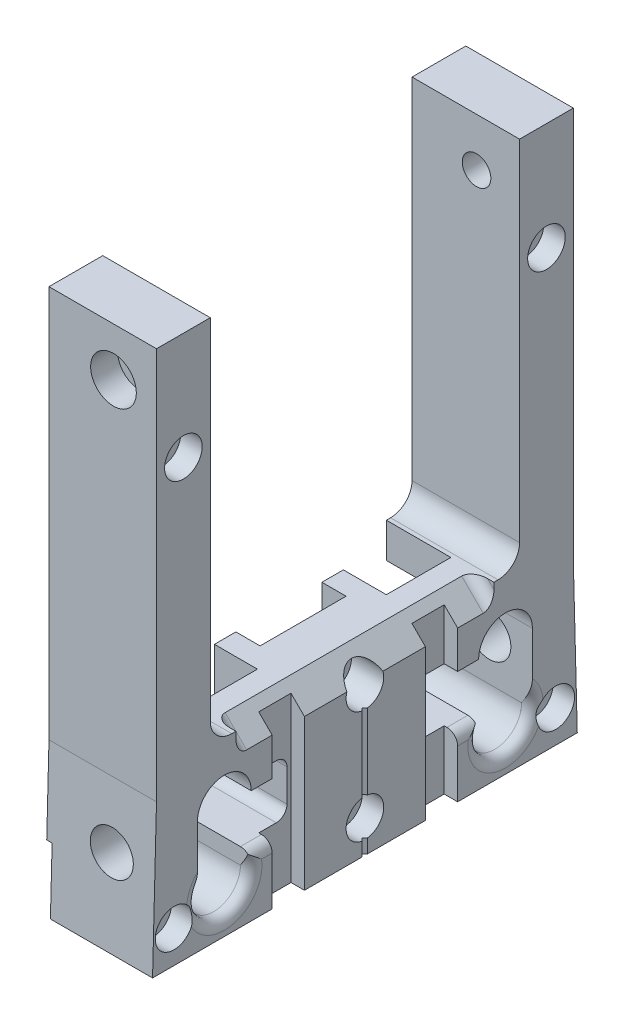
from build123d import *

# Parameters (mm, degrees)
SKETCH1_W                                         = 31.75
SKETCH1_H                                         = 160.3375
EXTRUDE1_DEPTH                                    = 62.70625
EXTRUDE2_DEPTH                                    = 107.616906566
EXTRUDE3_REACH                                    = 108.617
SKETCH15_W                                        = 3.96875
SKETCH15_H                                        = 9.525
EXTRUDE6_DEPTH                                    = 173.893618507
CUT_EXTRUDE1_DEPTH                                = 107.616906566
SKETCH17_W                                        = 1.5875
SKETCH17_H                                        = 19.177
CUT_EXTRUDE2_DEPTH                                = 96.8375
CBORE_FOR_1_4_SOCKET_HEAD_CAP_SCREW4_D            = 6.7564
CBORE_FOR_1_4_SOCKET_HEAD_CAP_SCREW4_CBORE_D      = 11.1125
CBORE_FOR_1_4_SOCKET_HEAD_CAP_SCREW4_CBORE_DEPTH  = 6.35
CBORE_FOR_5_16_SOCKET_HEAD_CAP_SCREW2_D           = 8.4328
CBORE_FOR_5_16_SOCKET_HEAD_CAP_SCREW2_DEPTH       = 15.875
CBORE_FOR_5_16_SOCKET_HEAD_CAP_SCREW2_CBORE_D     = 13.49502
CBORE_FOR_5_16_SOCKET_HEAD_CAP_SCREW2_CBORE_DEPTH = 7.9375
CBORE_FOR_5_16_SOCKET_HEAD_CAP_SCREW3_D           = 8.4328
CBORE_FOR_5_16_SOCKET_HEAD_CAP_SCREW3_CBORE_D     = 13.49502
CBORE_FOR_5_16_SOCKET_HEAD_CAP_SCREW3_CBORE_DEPTH = 7.9375
CBORE_FOR_1_4_SOCKET_HEAD_CAP_SCREW2_D            = 6.7564
CBORE_FOR_1_4_SOCKET_HEAD_CAP_SCREW2_CBORE_D      = 11.1125
CBORE_FOR_1_4_SOCKET_HEAD_CAP_SCREW2_CBORE_DEPTH  = 6.35
FILLET1_R                                         = 3.175
SKETCH32_R                                        = 6.35
CUT_EXTRUDE7_DEPTH                                = 22.225
CUT_EXTRUDE8_START                                = 22.225
SKETCH33_R                                        = 6.35
CUT_EXTRUDE8_DEPTH                                = 22.225
SKETCH41_W                                        = 19.05
SKETCH41_H                                        = 25.520262047
CUT_EXTRUDE9_DEPTH                                = 19.05
SKETCH43_W                                        = 6.35
SKETCH43_H                                        = 38.0746
CUT_EXTRUDE11_DEPTH                               = 22.225
CUT_EXTRUDE12_DEPTH                               = 7.14375
CBORE_FOR_1_4_SOCKET_HEAD_CAP_SCREW5_D            = 6.7564
CBORE_FOR_1_4_SOCKET_HEAD_CAP_SCREW5_CBORE_D      = 11.1125
CBORE_FOR_1_4_SOCKET_HEAD_CAP_SCREW5_CBORE_DEPTH  = 9.525
FILLET2_R                                         = 3.175
FILLET3_R                                         = 3.175
CUT_EXTRUDE13_DEPTH                               = 173.893618516
CUT_EXTRUDE14_DEPTH                               = 38.1
FILLET4_R                                         = 3.175


with BuildPart() as part:
    # Sketch1 → Extrude1 (new, symmetric)
    with BuildSketch(Plane.XY):
        Rectangle(SKETCH1_W, SKETCH1_H)
    extrude(amount=EXTRUDE1_DEPTH, both=True)

    # Sketch2 → Extrude2 (cut, through all)
    with BuildSketch(Plane(origin=(15.875, 0, 0), x_dir=(0, 0, -1), z_dir=(1, 0, 0))):
        Polygon((-62.70625, -80.16875), (-61.542285786, -35.71875), (-61.542285786, 80.16875), (-62.70625, 80.16875), align=None)
        Polygon((62.70625, -80.16875), (61.542285786, -35.71875), (61.542285786, 80.16875), (62.70625, 80.16875), align=None)
    extrude(amount=-EXTRUDE2_DEPTH, mode=Mode.SUBTRACT)

    # Sketch3 → Extrude3 (cut, up to next)
    with BuildSketch(Plane(origin=(15.875, 0, 0), x_dir=(0, 0, -1), z_dir=(1, 0, 0)), mode=Mode.PRIVATE) as extrude3_sk1:
        with BuildLine():
            Line((-19.0373, -59.53125), (-19.0373, -50.00625))
            ThreePointArc((-19.0373, -50.00625), (-19.96723597, -47.76118597), (-22.2123, -46.83125))
            Line((-22.2123, -46.83125), (-33.5788, -46.83125))
            ThreePointArc((-33.5788, -46.83125), (-41.5163, -38.89375), (-49.4538, -46.83125))
            Line((-49.4538, -46.83125), (-49.4538, -67.46875))
            ThreePointArc((-49.4538, -67.46875), (-41.5163, -75.40625), (-33.5788, -67.46875))
            Line((-33.5788, -67.46875), (-33.5788, -62.70625))
            Line((-33.5788, -62.70625), (-22.2123, -62.70625))
            ThreePointArc((-22.2123, -62.70625), (-19.96723597, -61.77631403), (-19.0373, -59.53125))
        make_face()
    extrude3_tool1 = extrude(extrude3_sk1.sketch, amount=-EXTRUDE3_REACH, mode=Mode.PRIVATE) & part.part
    # Sketch3 → Extrude3 (cut, up to next)
    with BuildSketch(Plane(origin=(15.875, 0, 0), x_dir=(0, 0, -1), z_dir=(1, 0, 0)), mode=Mode.PRIVATE) as extrude3_sk2:
        with BuildLine():
            Line((49.4538, -67.46875), (49.4538, -46.83125))
            ThreePointArc((49.4538, -46.83125), (41.5163, -38.89375), (33.5788, -46.83125))
            Line((33.5788, -46.83125), (22.2123, -46.83125))
            ThreePointArc((22.2123, -46.83125), (19.96723597, -47.76118597), (19.0373, -50.00625))
            Line((19.0373, -50.00625), (19.0373, -59.53125))
            ThreePointArc((19.0373, -59.53125), (19.96723597, -61.77631403), (22.2123, -62.70625))
            Line((22.2123, -62.70625), (33.5788, -62.70625))
            Line((33.5788, -62.70625), (33.5788, -67.46875))
            ThreePointArc((33.5788, -67.46875), (41.5163, -75.40625), (49.4538, -67.46875))
        make_face()
    extrude3_tool2 = extrude(extrude3_sk2.sketch, amount=-EXTRUDE3_REACH, mode=Mode.PRIVATE) & part.part
    add(extrude3_tool1.solids().sort_by_distance((15.875, -56.432782, 36.973416))[0], mode=Mode.SUBTRACT)
    add(extrude3_tool2.solids().sort_by_distance((15.875, -56.432782, -36.973416))[0], mode=Mode.SUBTRACT)

    # Sketch15 → Extrude6 (cut, through all)
    with BuildSketch(Plane(origin=(0, 80.16875, 0), x_dir=(1, 0, 0), z_dir=(0, 1, 0))):
        with Locations((13.890625, -22.621875)):
            Rectangle(SKETCH15_W, SKETCH15_H)
        with Locations((13.890625, 22.621875)):
            Rectangle(SKETCH15_W, SKETCH15_H)
    extrude(amount=-EXTRUDE6_DEPTH, mode=Mode.SUBTRACT)

    # Sketch16 → Cut-Extrude1 (cut, through all)
    with BuildSketch(Plane(origin=(15.875, 0, 0), x_dir=(0, 0, -1), z_dir=(1, 0, 0))):
        with BuildLine():
            Line((-45.667285786, 80.16875), (45.667285786, 80.16875))
            Line((45.667285786, 80.16875), (45.667285786, -23.01875))
            ThreePointArc((45.667285786, -23.01875), (43.807413847, -27.508878061), (39.317285786, -29.36875))
            Line((39.317285786, -29.36875), (-39.317285786, -29.36875))
            ThreePointArc((-39.317285786, -29.36875), (-43.807413847, -27.508878061), (-45.667285786, -23.01875))
            Line((-45.667285786, -23.01875), (-45.667285786, 80.16875))
        make_face()
    extrude(amount=-CUT_EXTRUDE1_DEPTH, mode=Mode.SUBTRACT)

    # Sketch17 → Cut-Extrude2 (cut, symmetric)
    with BuildSketch(Plane.XY):
        with Locations((-15.08125, -70.58025)):
            Rectangle(SKETCH17_W, SKETCH17_H)
    extrude(amount=CUT_EXTRUDE2_DEPTH, both=True, mode=Mode.SUBTRACT)

    # CBORE for 1/4 Socket Head Cap Screw4 (through all)
    with Locations(Plane(origin=(15.875, 0, 0), x_dir=(0, 0, -1), z_dir=(1, 0, 0))):
        with Locations((-56.35625, -70.58025), (56.35625, -70.58025), (0, -70.58025)):
            CounterBoreHole(CBORE_FOR_1_4_SOCKET_HEAD_CAP_SCREW4_D / 2, CBORE_FOR_1_4_SOCKET_HEAD_CAP_SCREW4_CBORE_D / 2, CBORE_FOR_1_4_SOCKET_HEAD_CAP_SCREW4_CBORE_DEPTH)

    # CBORE for 5/16 Socket Head Cap Screw2
    with Locations(Plane(origin=(0, 0, -61.542285786), x_dir=(-1, 0, 0), z_dir=(0, 0, -1))):
        with Locations((-3.175, 65.88125)):
            CounterBoreHole(CBORE_FOR_5_16_SOCKET_HEAD_CAP_SCREW2_D / 2, CBORE_FOR_5_16_SOCKET_HEAD_CAP_SCREW2_CBORE_D / 2, CBORE_FOR_5_16_SOCKET_HEAD_CAP_SCREW2_CBORE_DEPTH, depth=CBORE_FOR_5_16_SOCKET_HEAD_CAP_SCREW2_DEPTH)

    # CBORE for 5/16 Socket Head Cap Screw3 (through all)
    with Locations(Plane.XY.offset(61.542285786)):
        with Locations((3.175, 65.88125)):
            CounterBoreHole(CBORE_FOR_5_16_SOCKET_HEAD_CAP_SCREW3_D / 2, CBORE_FOR_5_16_SOCKET_HEAD_CAP_SCREW3_CBORE_D / 2, CBORE_FOR_5_16_SOCKET_HEAD_CAP_SCREW3_CBORE_DEPTH)

    # CBORE for 1/4 Socket Head Cap Screw2 (through all)
    with Locations(Plane(origin=(15.875, 0, 0), x_dir=(0, 0, -1), z_dir=(1, 0, 0))):
        with Locations((53.604785786, 48.41875), (-53.604785786, 48.41875)):
            CounterBoreHole(CBORE_FOR_1_4_SOCKET_HEAD_CAP_SCREW2_D / 2, CBORE_FOR_1_4_SOCKET_HEAD_CAP_SCREW2_CBORE_D / 2, CBORE_FOR_1_4_SOCKET_HEAD_CAP_SCREW2_CBORE_DEPTH)

    # Fillet1
    fillet1_edges = [part.edges().sort_by_distance(p)[0] for p in [
        (15.875, -62.70625, -30.4815875),
        (15.875, -62.70625, 30.4815875),
    ]]
    fillet(fillet1_edges, radius=FILLET1_R)

    # Sketch32 → Cut-Extrude7 (cut)
    with BuildSketch(Plane.XY.offset(63.5)):
        with Locations((3.175, -54.76875)):
            Circle(SKETCH32_R)
    extrude(amount=-CUT_EXTRUDE7_DEPTH, mode=Mode.SUBTRACT)

    # Sketch33 → Cut-Extrude8 (cut)
    with BuildSketch(Plane.XY.offset(-63.5).offset(CUT_EXTRUDE8_START)):
        with Locations((3.175, -54.76875)):
            Circle(SKETCH33_R)
    extrude(amount=-CUT_EXTRUDE8_DEPTH, mode=Mode.SUBTRACT)

    # Sketch41 → Cut-Extrude9 (cut)
    with BuildSketch(Plane.ZY.offset(15.875)):
        with Locations((-28.5623, -42.008618977)):
            Rectangle(SKETCH41_W, SKETCH41_H)
        with Locations((28.5623, -42.008618977)):
            Rectangle(SKETCH41_W, SKETCH41_H)
    extrude(amount=-CUT_EXTRUDE9_DEPTH, mode=Mode.SUBTRACT)

    # Sketch43 → Cut-Extrude11 (cut)
    with BuildSketch(Plane(origin=(0, -29.36875, 0), x_dir=(1, 0, 0), z_dir=(0, 1, 0))):
        with Locations((-12.7, 0)):
            Rectangle(SKETCH43_W, SKETCH43_H)
    extrude(amount=-CUT_EXTRUDE11_DEPTH, mode=Mode.SUBTRACT)

    # Sketch44 → Cut-Extrude12 (cut)
    with BuildSketch(Plane.ZY.offset(9.525)):
        with BuildLine():
            Line((-12.7, -29.36875), (12.7, -29.36875))
            Line((12.7, -29.36875), (12.7, -42.8625))
            ThreePointArc((12.7, -42.8625), (11.77006403, -45.10756403), (9.525, -46.0375))
            Line((9.525, -46.0375), (-9.525, -46.0375))
            ThreePointArc((-9.525, -46.0375), (-11.77006403, -45.10756403), (-12.7, -42.8625))
            Line((-12.7, -42.8625), (-12.7, -29.36875))
        make_face()
    extrude(amount=-CUT_EXTRUDE12_DEPTH, mode=Mode.SUBTRACT)

    # CBORE for 1/4 Socket Head Cap Screw5 (through all)
    with Locations(Plane(origin=(15.875, 0, 0), x_dir=(0, 0, -1), z_dir=(1, 0, 0))):
        with Locations((0, -37.30625)):
            CounterBoreHole(CBORE_FOR_1_4_SOCKET_HEAD_CAP_SCREW5_D / 2, CBORE_FOR_1_4_SOCKET_HEAD_CAP_SCREW5_CBORE_D / 2, CBORE_FOR_1_4_SOCKET_HEAD_CAP_SCREW5_CBORE_DEPTH)

    # Fillet2
    # the kernel refuses this fillet: 3.175 mm, written as the material it takes off along each edge
    with BuildSketch(Plane(origin=(15.875, -67.46875, -41.5163), x_dir=(0, 0.842338804567458, 0.5389483633149522), z_dir=(0, 0.5389483633149522, -0.842338804567458))) as fillet2_piece_1:
        with BuildLine():
            CenterArc((7.9375 + FILLET2_R, -FILLET2_R), FILLET2_R, 90, 90)
            Line((7.9375, -FILLET2_R), (7.9375, 0))
            Line((7.9375, 0), (7.9375 + FILLET2_R, 0))
        make_face()
    revolve(axis=Axis((15.875, -67.46875, -41.5163), (1, 0, 0)), revolution_arc=294.775843921, mode=Mode.SUBTRACT)

    # Fillet3
    # the kernel refuses this fillet: 3.175 mm, written as the material it takes off along each edge
    with BuildSketch(Plane(origin=(15.875, -67.46875, 41.5163), x_dir=(0, 0.842338804567458, 0.5389483633149522), z_dir=(0, 0.5389483633149522, -0.842338804567458))) as fillet3_piece_1:
        with BuildLine():
            CenterArc((7.9375 + FILLET3_R, -FILLET3_R), FILLET3_R, 90, 90)
            Line((7.9375, -FILLET3_R), (7.9375, 0))
            Line((7.9375, 0), (7.9375 + FILLET3_R, 0))
        make_face()
    revolve(axis=Axis((15.875, -67.46875, 41.5163), (1, 0, 0)), revolution_arc=294.775843921, mode=Mode.SUBTRACT)

    # Sketch48 → Cut-Extrude13 (cut, through all)
    with BuildSketch(Plane.XZ.offset(80.16875)):
        Polygon((15.875, 0.79375), (15.08125, 0), (15.875, -0.79375), align=None)
    extrude(amount=-CUT_EXTRUDE13_DEPTH, mode=Mode.SUBTRACT)

    # Sketch49 → Cut-Extrude14 (cut, symmetric)
    with BuildSketch(Plane.XY):
        Polygon((15.875, -29.36875), (9.525, -29.36875), (15.875, -35.71875), align=None)
    extrude(amount=CUT_EXTRUDE14_DEPTH, both=True, mode=Mode.SUBTRACT)

    # Fillet4
    fillet4_edges = [part.edges().sort_by_distance(p)[0] for p in [
        (12.7, -32.54375, -38.1),
        (12.7, -32.54375, 38.1),
    ]]
    fillet(fillet4_edges, radius=FILLET4_R)


solid = part.part
